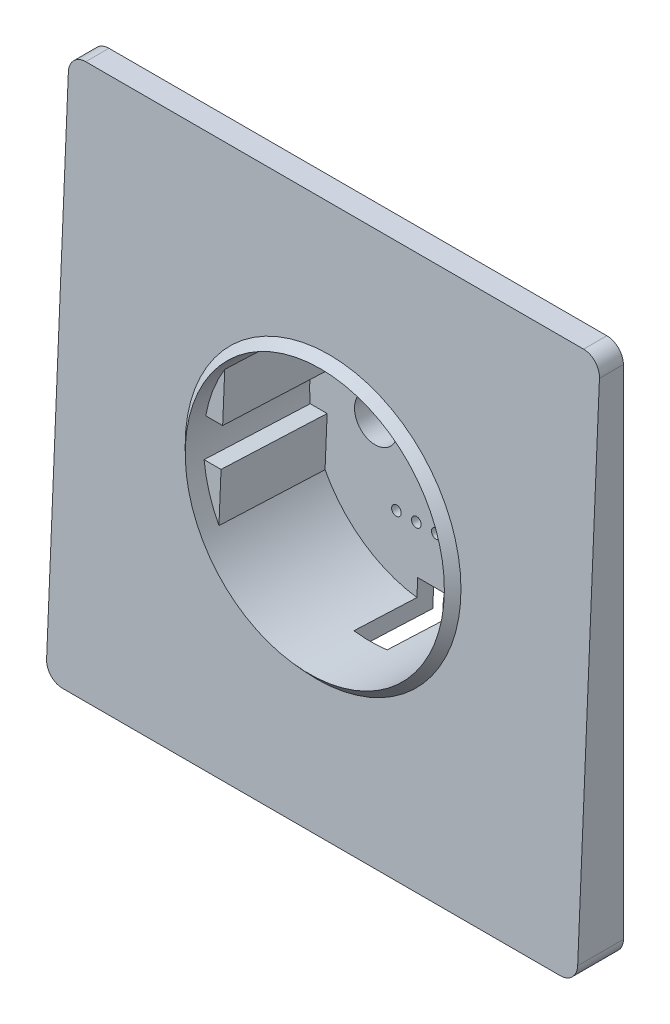
from build123d import *

# Parameters (mm, degrees)
IZIM1_W                      = 75
IZIM1_H                      = 75
EKSTR_ZYON_NCE3_DEPTH        = 7
KES_EKSTR_ZYON3_DEPTH        = 112.5
IZIM7_W                      = 76.655022697
IZIM7_H                      = 76.831895908
Y_KSEKLIK_EKSTR_ZYON15_DEPTH = 2.5
IZIM8_R                      = 19.5
KES_EKSTR_ZYON4_DEPTH        = 17.5
IZIM9_R                      = 20.75
Y_KSEKLIK_EKSTR_ZYON16_DEPTH = 17.5
IZIM10_R                     = 19.5
KES_EKSTR_ZYON5_DEPTH        = 17.5
Y_KSEKLIK_EKSTR_ZYON17_START = 1.5
IZIM11_R                     = 20.75
IZIM11_R_2                   = 19.5
Y_KSEKLIK_EKSTR_ZYON17_DEPTH = 1.5
PAH1_SIZE                    = 1.5
IZIM12_R                     = 20.75
Y_KSEKLIK_EKSTR_ZYON18_DEPTH = 2.5
IZIM13_R                     = 3.25
KES_EKSTR_ZYON7_DEPTH        = 2.5
KES_EKSTR_ZYON8_DEPTH        = 16
IZIM16_W                     = 5
IZIM16_H                     = 5
KES_EKSTR_ZYON10_DEPTH       = 12
Y_KSEKLIK_EKSTR_ZYON21_START = 16
Y_KSEKLIK_EKSTR_ZYON21_DEPTH = 16
IZIM17_W                     = 15
IZIM17_H                     = 2.5
KES_EKSTR_ZYON14_DEPTH       = 0.5
IZIM19_R                     = 0.725
KES_EKSTR_ZYON15_DEPTH       = 20.5
IZIM20_W                     = 17
IZIM20_H                     = 4.5
IZIM20_W_2                   = 15
IZIM20_H_2                   = 2.5
Y_KSEKLIK_EKSTR_ZYON23_DEPTH = 1
IZIM22_R                     = 4.25
IZIM22_R_2                   = 3.25
Y_KSEKLIK_EKSTR_ZYON26_DEPTH = 2.5
Y_KSEKLIK_EKSTR_ZYON27_DEPTH = 13
IZIM27_W                     = 1
IZIM27_H                     = 5.777952228
KES_EKSTR_ZYON18_DEPTH       = 4
IZIM31_R                     = 0.725
KES_EKSTR_ZYON19_DEPTH       = 5
PAH5_SIZE                    = 1
IZIM32_R                     = 3.25
IZIM32_R_2                   = 0.75
Y_KSEKLIK_EKSTR_ZYON29_DEPTH = 13
KES_EKSTR_ZYON29_DEPTH       = 21
IZIM40_W                     = 52
IZIM40_H                     = 4.388233566
KES_EKSTR_ZYON30_DEPTH       = 0.9
IZIM45_R                     = 22
IZIM45_R_2                   = 20.75
Y_KSEKLIK_EKSTR_ZYON31_DEPTH = 17.5
IZIM46_W                     = 5
IZIM46_H                     = 7.879420983
KES_EKSTR_ZYON32_DEPTH       = 12


with BuildPart() as part:
    # Çizim1 → Ekstrüzyon-İnce3 (new body)
    with BuildSketch(Plane.XY):
        with BuildLine():
            Line((-37.5, 40), (37.5, 40))
            ThreePointArc((37.5, 40), (39.267766953, 39.267766953), (40, 37.5))
            Line((40, 37.5), (40, -37.5))
            ThreePointArc((40, -37.5), (39.267766953, -39.267766953), (37.5, -40))
            Line((37.5, -40), (-37.5, -40))
            ThreePointArc((-37.5, -40), (-39.267766953, -39.267766953), (-40, -37.5))
            Line((-40, -37.5), (-40, 37.5))
            ThreePointArc((-40, 37.5), (-39.267766953, 39.267766953), (-37.5, 40))
        make_face()
        Rectangle(IZIM1_W, IZIM1_H, mode=Mode.SUBTRACT)
    extrude(amount=EKSTR_ZYON_NCE3_DEPTH)

    # Çizim6 → Kes-Ekstrüzyon3 (cut)
    with BuildSketch(Plane(origin=(40, 0, 0), x_dir=(0, 0, -1), z_dir=(1, 0, 0))):
        Polygon((-3.5, 40), (-7, -40), (-7, 40), align=None)
    extrude(amount=-KES_EKSTR_ZYON3_DEPTH, mode=Mode.SUBTRACT)

    # Çizim7 → Yükseklik-Ekstrüzyon15 (add)
    with BuildSketch(Plane(origin=(0, 0.229248704, 5.239970369), x_dir=(1, 0, 0), z_dir=(0, 0.04370818989361564, 0.9990443404255007))):
        with Locations((0.051724036, -0.074147453)):
            Rectangle(IZIM7_W, IZIM7_H)
    extrude(amount=-Y_KSEKLIK_EKSTR_ZYON15_DEPTH)

    # Çizim8 → Kes-Ekstrüzyon4 (cut)
    with BuildSketch(Plane(origin=(0, 0.229248704, 5.239970369), x_dir=(1, 0, 0), z_dir=(0, 0.04370818989361564, 0.9990443404255007))):
        with Locations(Location((0, 0, 0), (0, 0, 270))):
            Circle(IZIM8_R)
    extrude(amount=-KES_EKSTR_ZYON4_DEPTH, mode=Mode.SUBTRACT)

    # Çizim9 → Yükseklik-Ekstrüzyon16 (add)
    with BuildSketch(Plane(origin=(0, 0.229248704, 5.239970369), x_dir=(1, 0, 0), z_dir=(0, 0.04370818989361564, 0.9990443404255007))):
        with Locations(Location((0, 0, 0), (0, 0, 270))):
            Circle(IZIM9_R)
    extrude(amount=-Y_KSEKLIK_EKSTR_ZYON16_DEPTH)

    # Çizim10 → Kes-Ekstrüzyon5 (cut)
    with BuildSketch(Plane(origin=(0, 0.229248704, 5.239970369), x_dir=(1, 0, 0), z_dir=(0, 0.04370818989361564, 0.9990443404255007))):
        with Locations(Location((0, 0, 0), (0, 0, 270))):
            Circle(IZIM10_R)
    extrude(amount=-KES_EKSTR_ZYON5_DEPTH, mode=Mode.SUBTRACT)

    # Çizim11 → Yükseklik-Ekstrüzyon17 (add)
    with BuildSketch(Plane(origin=(0, 0.229248704, 5.239970369), x_dir=(1, 0, 0), z_dir=(0, 0.04370818989361564, 0.9990443404255007)).offset(Y_KSEKLIK_EKSTR_ZYON17_START)):
        with Locations(Location((0, 0, 0), (0, 0, 270))):
            Circle(IZIM11_R)
        with Locations(Location((0, 0, 0), (0, 0, 270))):
            Circle(IZIM11_R_2, mode=Mode.SUBTRACT)
    extrude(amount=-Y_KSEKLIK_EKSTR_ZYON17_DEPTH)

    # Pah1
    # the kernel refuses this chamfer: 1.5 mm, written as the material it takes off along each edge
    with BuildSketch(Plane(origin=(0, 0.294810988, 6.73853688), x_dir=(0, -0.9990443404255006, 0.04370818989361566), z_dir=(-1, 0, 0))) as pah1_piece_1_section:
        Polygon((20.75, -PAH1_SIZE), (20.75 - PAH1_SIZE, 0), (20.75, 0), align=None)
    pah1_piece_1 = revolve(axis=Axis((0, 0.294810988, 6.73853688), (0, 0.04370818989361564, 0.9990443404255007)), mode=Mode.PRIVATE)
    pah1_piece_1 = split(pah1_piece_1, bisect_by=Plane(origin=(0, 20.227075284, 4.365065456), z_dir=(0, 0.043708189893615655, 0.9990443404255007)), keep=Keep.TOP, mode=Mode.PRIVATE)
    add(pah1_piece_1, mode=Mode.SUBTRACT)

    # Çizim12 → Yükseklik-Ekstrüzyon18 (add)
    with BuildSketch(Plane(origin=(0, -0.535644619, -12.243305588), x_dir=(-1, 0, 0), z_dir=(0, -0.04370818989361565, -0.9990443404255007))):
        with Locations(Location((0, 0, 0), (0, 0, 270))):
            Circle(IZIM12_R)
    extrude(amount=Y_KSEKLIK_EKSTR_ZYON18_DEPTH)

    # Çizim13 → Kes-Ekstrüzyon7 (cut)
    with BuildSketch(Plane(origin=(0, -0.535644619, -12.243305588), x_dir=(1, 0, 0), z_dir=(0, 0.043708189893615655, 0.9990443404255007))):
        with Locations(Location((-9.5, 0, 0), (0, 0, 270))):
            Circle(IZIM13_R)
        with Locations(Location((9.5, 0, 0), (0, 0, 270))):
            Circle(IZIM13_R)
    extrude(amount=-KES_EKSTR_ZYON7_DEPTH, mode=Mode.SUBTRACT)

    # Çizim15 → Kes-Ekstrüzyon8 (cut)
    with BuildSketch(Plane(origin=(0, -0.535644619, -12.243305588), x_dir=(1, 0, 0), z_dir=(0, 0.043708189893615655, 0.9990443404255007))):
        with BuildLine():
            ThreePointArc((2.5, 19.339079606), (0, 19.5), (-2.5, 19.339079606))
            Line((-2.5, 19.339079606), (-2.5, 16.789079606))
            Line((-2.5, 16.789079606), (2.5, 16.789079606))
            Line((2.5, 16.789079606), (2.5, 19.339079606))
        make_face()
        with BuildLine():
            ThreePointArc((-2.5, -19.339079606), (0, -19.5), (2.5, -19.339079606))
            Line((2.5, -19.339079606), (2.5, -16.789079606))
            Line((2.5, -16.789079606), (-2.5, -16.789079606))
            Line((-2.5, -16.789079606), (-2.5, -19.339079606))
        make_face()
    extrude(amount=-KES_EKSTR_ZYON8_DEPTH, mode=Mode.SUBTRACT)

    # Çizim16 → Kes-Ekstrüzyon10 (cut)
    with BuildSketch(Plane(origin=(0, -0.644915094, -14.740916439), x_dir=(-1, 0, 0), z_dir=(0, -0.043708189893615655, -0.9990443404255007))):
        with Locations((0, 19.289079606)):
            Rectangle(IZIM16_W, IZIM16_H)
        with Locations((0, -19.289079606)):
            Rectangle(IZIM16_W, IZIM16_H)
    extrude(amount=-KES_EKSTR_ZYON10_DEPTH, mode=Mode.SUBTRACT)

    # Çizim14 → Yükseklik-Ekstrüzyon21 (add)
    with BuildSketch(Plane(origin=(0, -0.535644619, -12.243305588), x_dir=(1, 0, 0), z_dir=(0, 0.043708189893615655, 0.9990443404255007)).offset(Y_KSEKLIK_EKSTR_ZYON21_START)):
        with BuildLine():
            Line((-16.75, 2.8), (-16.75, 9.984362774))
            ThreePointArc((-16.75, 9.984362774), (-18.37843937, 6.517895851), (-19.29792735, 2.8))
            Line((-19.29792735, 2.8), (-16.75, 2.8))
        make_face()
        with BuildLine():
            ThreePointArc((-19.29792735, -2.8), (-18.37843937, -6.517895851), (-16.75, -9.984362774))
            Line((-16.75, -9.984362774), (-16.75, -2.8))
            Line((-16.75, -2.8), (-19.29792735, -2.8))
        make_face()
        with BuildLine():
            Line((16.75, 2.8), (19.29792735, 2.8))
            ThreePointArc((19.29792735, 2.8), (18.37843937, 6.517895851), (16.75, 9.984362774))
            Line((16.75, 9.984362774), (16.75, 2.8))
        make_face()
        with BuildLine():
            ThreePointArc((16.75, -9.984362774), (18.37843937, -6.517895851), (19.29792735, -2.8))
            Line((19.29792735, -2.8), (16.75, -2.8))
            Line((16.75, -2.8), (16.75, -9.984362774))
        make_face()
    extrude(amount=-Y_KSEKLIK_EKSTR_ZYON21_DEPTH)

    # Çizim17 → Kes-Ekstrüzyon14 (cut)
    with BuildSketch(Plane(origin=(0, -0.644915094, -14.740916439), x_dir=(-1, 0, 0), z_dir=(0, -0.043708189893615655, -0.9990443404255007))):
        with Locations((0, -9.939079606)):
            Rectangle(IZIM17_W, IZIM17_H)
    extrude(amount=-KES_EKSTR_ZYON14_DEPTH, mode=Mode.SUBTRACT)

    # Çizim19 → Kes-Ekstrüzyon15 (cut)
    with BuildSketch(Plane(origin=(0, -0.623060999, -14.241394269), x_dir=(-1, 0, 0), z_dir=(0, -0.04370818989361531, -0.9990443404255007))):
        with Locations(Location((0, -9.939079606, 0), (0, 0, 90))):
            Circle(IZIM19_R)
        with Locations(Location((3, -9.939079606, 0), (0, 0, 90))):
            Circle(IZIM19_R)
        with Locations(Location((6, -9.939079606, 0), (0, 0, 90))):
            Circle(IZIM19_R)
        with Locations(Location((-3, -9.939079606, 0), (0, 0, 90))):
            Circle(IZIM19_R)
        with Locations(Location((-6, -9.939079606, 0), (0, 0, 90))):
            Circle(IZIM19_R)
    extrude(amount=-KES_EKSTR_ZYON15_DEPTH, mode=Mode.SUBTRACT)

    # Çizim20 → Yükseklik-Ekstrüzyon23 (add)
    with BuildSketch(Plane(origin=(0, -0.644915094, -14.740916439), x_dir=(-1, 0, 0), z_dir=(0, -0.043708189893615655, -0.9990443404255007))):
        with Locations((0, -9.939079606)):
            Rectangle(IZIM20_W, IZIM20_H)
        with Locations((0, -9.939079606)):
            Rectangle(IZIM20_W_2, IZIM20_H_2, mode=Mode.SUBTRACT)
    extrude(amount=Y_KSEKLIK_EKSTR_ZYON23_DEPTH)

    # Çizim22 → Yükseklik-Ekstrüzyon26 (add)
    # profile 1 of 2: a face of its own
    with BuildSketch(Plane(origin=(0, -0.644915094, -14.740916439), x_dir=(-1, 0, 0), z_dir=(0, -0.043708189893615655, -0.9990443404255007))):
        with Locations(Location((-9.5, 0, 0), (0, 0, 90))):
            Circle(IZIM22_R)
        with Locations(Location((-9.5, 0, 0), (0, 0, 270))):
            Circle(IZIM22_R_2, mode=Mode.SUBTRACT)
    # profile 2 of 2: a face of its own
    with BuildSketch(Plane(origin=(0, -0.644915094, -14.740916439), x_dir=(-1, 0, 0), z_dir=(0, -0.043708189893615655, -0.9990443404255007))):
        with Locations(Location((9.5, 0, 0), (0, 0, 90))):
            Circle(IZIM22_R)
        with Locations(Location((9.5, 0, 0), (0, 0, 270))):
            Circle(IZIM22_R_2, mode=Mode.SUBTRACT)
    extrude(amount=Y_KSEKLIK_EKSTR_ZYON26_DEPTH)

    # Çizim26 → Yükseklik-Ekstrüzyon27 (add)
    with BuildSketch(Plane(origin=(0, -0.644915094, -14.740916439), x_dir=(-1, 0, 0), z_dir=(0, -0.043708189893615655, -0.9990443404255007))):
        with BuildLine():
            Line((-11, 8.97649343), (-11, 3.97649343))
            ThreePointArc((-11, 3.97649343), (-9.5, 4.25), (-8, 3.97649343))
            Line((-8, 3.97649343), (-8, 8.97649343))
            ThreePointArc((-8, 8.97649343), (-8.292893219, 9.683600211), (-9, 9.97649343))
            Line((-9, 9.97649343), (-10, 9.97649343))
            ThreePointArc((-10, 9.97649343), (-10.707106781, 9.683600211), (-11, 8.97649343))
        make_face()
        with BuildLine():
            Line((8, 8.97649343), (8, 3.97649343))
            ThreePointArc((8, 3.97649343), (9.5, 4.25), (11, 3.97649343))
            Line((11, 3.97649343), (11, 8.97649343))
            ThreePointArc((11, 8.97649343), (10.707106781, 9.683600211), (10, 9.97649343))
            Line((10, 9.97649343), (9, 9.97649343))
            ThreePointArc((9, 9.97649343), (8.292893219, 9.683600211), (8, 8.97649343))
        make_face()
        with BuildLine():
            Line((8, -3.97649343), (8, -7.689079606))
            Line((8, -7.689079606), (8.5, -7.689079606))
            Line((8.5, -7.689079606), (8.5, -9.842518834))
            ThreePointArc((8.5, -9.842518834), (8.741180955, -9.942419256), (9, -9.97649343))
            Line((9, -9.97649343), (10, -9.97649343))
            ThreePointArc((10, -9.97649343), (10.707106781, -9.683600211), (11, -8.97649343))
            Line((11, -8.97649343), (11, -3.97649343))
            ThreePointArc((11, -3.97649343), (9.5, -4.25), (8, -3.97649343))
        make_face()
        with BuildLine():
            Line((-8.5, -7.689079606), (-8, -7.689079606))
            Line((-8, -7.689079606), (-8, -3.97649343))
            ThreePointArc((-8, -3.97649343), (-9.5, -4.25), (-11, -3.97649343))
            Line((-11, -3.97649343), (-11, -8.97649343))
            ThreePointArc((-11, -8.97649343), (-10.707106781, -9.683600211), (-10, -9.97649343))
            Line((-10, -9.97649343), (-9, -9.97649343))
            ThreePointArc((-9, -9.97649343), (-8.741180955, -9.942419256), (-8.5, -9.842518834))
            Line((-8.5, -9.842518834), (-8.5, -7.689079606))
        make_face()
    extrude(amount=Y_KSEKLIK_EKSTR_ZYON27_DEPTH)

    # Çizim27 → Kes-Ekstrüzyon18 (cut)
    with BuildSketch(Plane(origin=(0, -1.213121563, -27.728492865), x_dir=(-1, 0, 0), z_dir=(0, -0.043708189893615655, -0.9990443404255007))):
        with Locations((-9.5, 7.087517316)):
            Rectangle(IZIM27_W, IZIM27_H)
        with Locations((9.5, 7.087517316)):
            Rectangle(IZIM27_W, IZIM27_H)
        with Locations((9.5, -7.087517316)):
            Rectangle(IZIM27_W, IZIM27_H)
        with Locations((-9.5, -7.087517316)):
            Rectangle(IZIM27_W, IZIM27_H)
    extrude(amount=-KES_EKSTR_ZYON18_DEPTH, mode=Mode.SUBTRACT)

    # Çizim31 → Kes-Ekstrüzyon19 (cut)
    with BuildSketch(Plane(origin=(0, -12.177430995, 0.532762606), x_dir=(1, 0, 0), z_dir=(0, -0.9990443404255007, 0.04370818989361566))):
        with Locations((0, -15.755017213)):
            Circle(IZIM31_R)
        with Locations((3, -15.755017213)):
            Circle(IZIM31_R)
        with Locations((6, -15.755017213)):
            Circle(IZIM31_R)
        with Locations((-3, -15.755017213)):
            Circle(IZIM31_R)
        with Locations((-6, -15.755017213)):
            Circle(IZIM31_R)
    extrude(amount=-KES_EKSTR_ZYON19_DEPTH, mode=Mode.SUBTRACT)

    # Pah5
    pah5_edges = [part.edges().sort_by_distance(p)[0] for p in [
        (-8, -6.472127454, -14.485975899),
        (8.741180955, -10.577832782, -14.30635129),
        (9.5, -10.611874393, -14.30486197),
        (11, -7.115219201, -14.457840635),
        (10.707106781, -10.31926108, -14.317663802),
        (8, -6.472127454, -14.485975899),
        (11, 5.825389013, -15.023992244),
        (10.707106781, 9.029430892, -15.164169076),
        (9.5, 9.322044204, -15.176970909),
        (8, 5.825389013, -15.023992244),
        (8.292893219, 9.029430892, -15.164169076),
        (-8, 5.825389013, -15.023992244),
        (-8.292893219, 9.029430892, -15.164169076),
        (-9.5, 9.322044204, -15.176970909),
        (-10.707106781, 9.029430892, -15.164169076),
        (-11, 5.825389013, -15.023992244),
        (-8.741180955, -10.577832782, -14.30635129),
        (-9.5, -10.611874393, -14.30486197),
        (-11, -7.115219201, -14.457840635),
        (-10.707106781, -10.31926108, -14.317663802),
    ]]
    chamfer(pah5_edges, length=PAH5_SIZE)

    # Çizim32 → Yükseklik-Ekstrüzyon29 (add)
    with BuildSketch(Plane(origin=(0, -0.644915094, -14.740916439), x_dir=(-1, 0, 0), z_dir=(0, -0.043708189893615655, -0.9990443404255007))):
        with Locations(Location((0, 0, 0), (0, 0, 90))):
            Circle(IZIM32_R)
        with Locations(Location((0, 0, 0), (0, 0, 90))):
            Circle(IZIM32_R_2, mode=Mode.SUBTRACT)
    extrude(amount=Y_KSEKLIK_EKSTR_ZYON29_DEPTH)

    # Çizim37 → Kes-Ekstrüzyon29 (cut)
    with BuildSketch(Plane(origin=(0, -37.5, 0), x_dir=(1, 0, 0), z_dir=(0, 1, 0))):
        with BuildLine():
            Line((22, 0), (18.634136343, -3.475340206))
            ThreePointArc((18.634136343, -3.475340206), (17.649333458, -4.150598487), (16.479145422, -4.388233566))
            Line((16.479145422, -4.388233566), (-16.479145422, -4.388233566))
            ThreePointArc((-16.479145422, -4.388233566), (-17.649333458, -4.150598487), (-18.634136343, -3.475340206))
            Line((-18.634136343, -3.475340206), (-22, 0))
            Line((-22, 0), (22, 0))
        make_face()
    extrude(amount=-KES_EKSTR_ZYON29_DEPTH, mode=Mode.SUBTRACT)

    # Çizim40 → Kes-Ekstrüzyon30 (cut)
    with BuildSketch(Plane(origin=(0, -37.5, 0), x_dir=(1, 0, 0), z_dir=(0, 1, 0))):
        with Locations((0, -2.194116783)):
            Rectangle(IZIM40_W, IZIM40_H)
    extrude(amount=-KES_EKSTR_ZYON30_DEPTH, mode=Mode.SUBTRACT)

    # Çizim45 → Yükseklik-Ekstrüzyon31 (add)
    with BuildSketch(Plane(origin=(0, 0.119978229, 2.742359518), x_dir=(-1, 0, 0), z_dir=(0, -0.04370818989361565, -0.9990443404255007))):
        with Locations(Location((0, 0, 0), (0, 0, 270))):
            Circle(IZIM45_R)
        Circle(IZIM45_R_2, mode=Mode.SUBTRACT)
    extrude(amount=Y_KSEKLIK_EKSTR_ZYON31_DEPTH)

    # Çizim46 → Kes-Ekstrüzyon32 (cut)
    with BuildSketch(Plane(origin=(0, -0.644915094, -14.740916439), x_dir=(-1, 0, 0), z_dir=(0, -0.043708189893615655, -0.9990443404255007))):
        with Locations((0, 20.728790098)):
            Rectangle(IZIM46_W, IZIM46_H)
        with Locations((0, -20.728790098)):
            Rectangle(IZIM46_W, IZIM46_H)
    extrude(amount=-KES_EKSTR_ZYON32_DEPTH, mode=Mode.SUBTRACT)


solid = part.part
